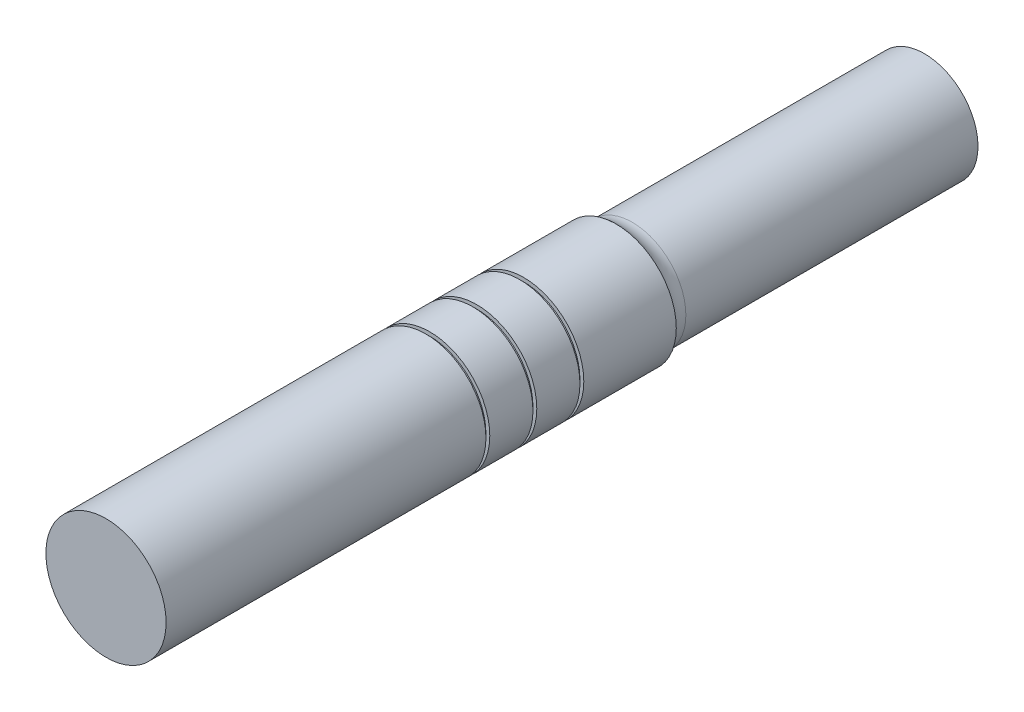
from build123d import *

# Parameters (mm, degrees)
REDONDEO1_R                      = 0.762
TALADRO_DE_MARGEN_PARA_101_D     = 2.3622
TALADRO_DE_MARGEN_PARA_101_DEPTH = 0.8636
TALADRO_DE_MARGEN_PARA_101_TIP   = 0.709676477
CHAFL_N1_SIZE2                   = 0.337288027
CHAFL_N1_SIZE                    = 0.5842


# Some blends are built 0.0001 mm under size
with BuildPart() as part:
    # Croquis1 → Revolución1 (revolve)
    with BuildSketch(Plane(origin=(0, 0, 0), x_dir=(0, 0, -1), z_dir=(1, 0, 0)), mode=Mode.PRIVATE) as revoluci_n1_sk:
        Polygon((-13.4874, 0), (-13.4874, 1.9812), (-2.9464, 1.9812), (-2.9464, 1.8542), (-2.8194, 1.8542), (-2.8194, 1.9812), (-1.397, 1.9812), (-1.397, 1.8542), (-1.27, 1.8542), (-1.27, 1.9812), (0.1524, 1.9812), (0.1524, 1.8542), (0.2794, 1.8542), (0.2794, 1.9812), (3.3274, 1.9812), (3.3274, 1.7653), (13.4874, 1.7653), (13.4874, 0), align=None)
    revolve(revoluci_n1_sk.sketch.rotate(Axis((0, 0, 127), (0, 0, -1)), 90), axis=Axis((0, 0, 127), (0, 0, -1)))

    # Redondeo1
    # the kernel refuses this fillet: 0.762 mm, written as the material it adds along each edge
    with BuildSketch(Plane(origin=(0, 0, -3.3274), x_dir=(1, 0, 0), z_dir=(0, 1, 0))) as redondeo1_piece_1:
        with BuildLine():
            CenterArc((2.5273, 0.531430889), REDONDEO1_R, 180, 44.220044428)
            Line((1.7653, 0.531430889), (1.75006, 0.531430889))
            Line((1.75006, 0.531430889), (1.75006, 0))
            Line((1.75006, 0), (1.7653, -0.01524))
            ThreePointArc((1.7653, -0.01524), (1.87325, -0.01524), (1.970278, -0.010628618))
            Line((1.970278, -0.010628618), (1.9812, 0))
        make_face()
    revolve(axis=Axis((0, 0, -3.3274), (0, 0, -1)))

    # Taladro de margen para #101
    with Locations(Plane(origin=(0, 0, -13.4874), x_dir=(-1, 0, 0), z_dir=(0, 0, -1))):
        with Locations((0, 0)):
            Hole(TALADRO_DE_MARGEN_PARA_101_D / 2, depth=TALADRO_DE_MARGEN_PARA_101_DEPTH)
            with Locations((0, 0, -(TALADRO_DE_MARGEN_PARA_101_DEPTH + TALADRO_DE_MARGEN_PARA_101_TIP / 2))):  # 118° drill point
                Cone(0, TALADRO_DE_MARGEN_PARA_101_D / 2, TALADRO_DE_MARGEN_PARA_101_TIP, mode=Mode.SUBTRACT)

    # Chaflán1
    chafl_n1_edges = [part.edges().sort_by_distance(p)[0] for p in [
        (-1.1811, 0, -13.4874),
    ]]
    chafl_n1_side = [part.faces().sort_by_distance(p)[0] for p in [
        (-1.187845761, 0, -13.4874),
    ]]
    chamfer(chafl_n1_edges, length=CHAFL_N1_SIZE - 0.0001, length2=CHAFL_N1_SIZE2 - 0.0001, reference=chafl_n1_side[0])  # a hair under: the kernel refuses the full size


solid = part.part
